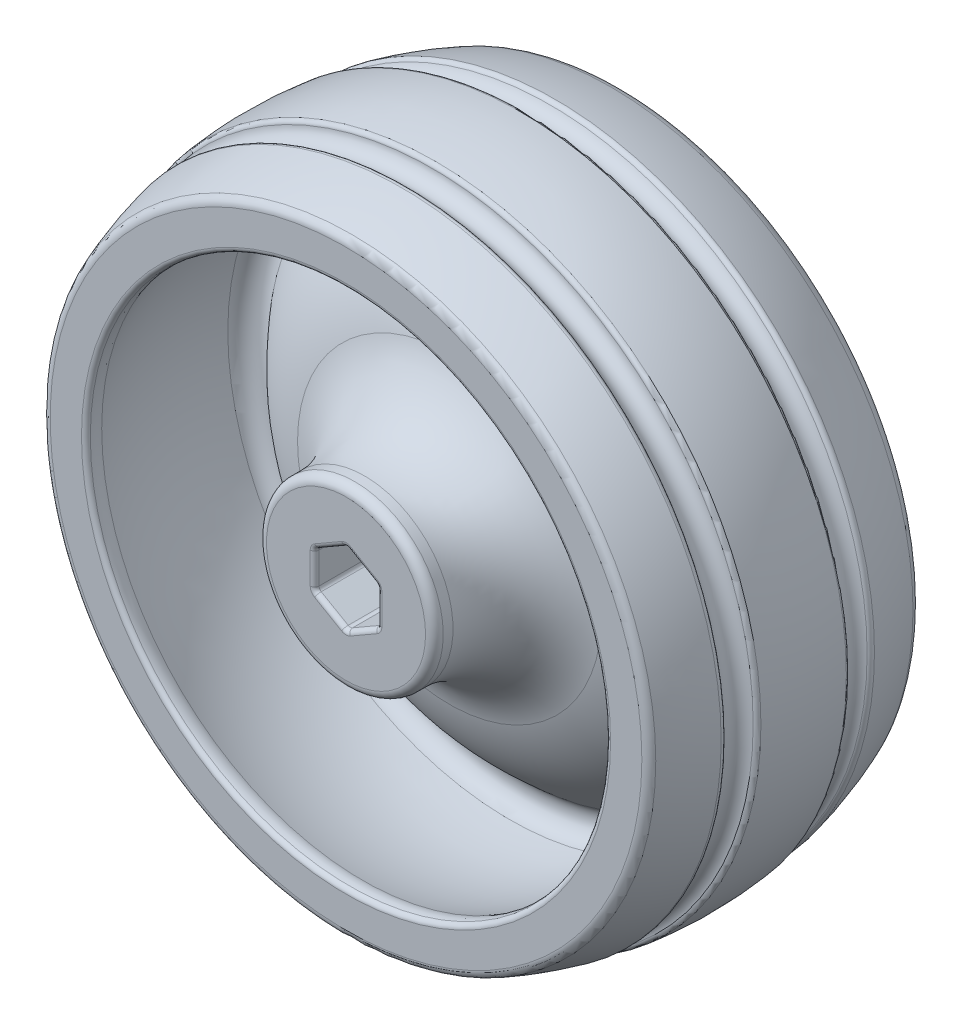
from build123d import *

# Parameters (mm, degrees)
SKETCH1_R           = 10
BOSS_EXTRUDE1_DEPTH = 15
FILLET1_R           = 10
CUT_EXTRUDE1_DEPTH  = 55.986436954
FILLET2_R           = 0.5
FILLET3_R           = 0.5
FILLET4_R           = 1
FILLET5_R           = 0.5
SKETCH5_R           = 36.834508169
CUT_EXTRUDE2_DEPTH  = 10
FILLET6_R           = 1
FILLET7_R           = 0.56


with BuildPart() as part:
    # Sketch1 → Boss-Extrude1 (new body)
    with BuildSketch(Plane.XY):
        Circle(SKETCH1_R)
        Polygon((0, 4.1), (-3.550704156, 2.05), (-3.550704156, -2.05), (0, -4.1), (3.550704156, -2.05), (3.550704156, 2.05), align=None, mode=Mode.SUBTRACT)
    extrude(amount=BOSS_EXTRUDE1_DEPTH)

    # Sketch3 → Revolve1 (revolve)
    with BuildSketch(Plane(origin=(0, 0, 0), x_dir=(1, 0, 0), z_dir=(0, 1, 0))):
        with BuildLine():
            Line((0, 0), (0, 2))
            add(Edge.make_bspline(
                [(0, 2), (-16.635779287, -1.704882491), (-22.019677578, 4.954669614), (-27.650661505, 11.418003497), (-29.619825905, 15.213752774)],
                knots=[0.020977686, 0.020977686, 0.020977686, 0.020977686, 0.802461476, 1.020977686, 1.020977686, 1.020977686, 1.020977686], degree=3))
            ThreePointArc((-29.619825905, 15.213752774), (-31.95663413, 16.559729671), (-34.156535975, 14.99999945))
            ThreePointArc((-34.156535975, 14.99999945), (-35.33748884, 11.662912363), (-36.218783716, 8.234484263))
            ThreePointArc((-36.218783716, 8.234484263), (-35.021582874, 6.507540388), (-36.725775642, 5.278169813))
            ThreePointArc((-36.725775642, 5.278169813), (-37.075543317, 0), (-36.725775642, -5.278169813))
            ThreePointArc((-36.725775642, -5.278169813), (-35.021582874, -6.507540388), (-36.218783716, -8.234484263))
            ThreePointArc((-36.218783716, -8.234484263), (-35.337488853, -11.66291232), (-34.156536009, -14.999999367))
            ThreePointArc((-34.156536009, -14.999999367), (-30.90147392, -16.380062106), (-29.521411796, -13.124999757))
            ThreePointArc((-29.521411796, -13.124999757), (-31.724157563, -4.947072955), (-31.898033904, 3.520532533))
            ThreePointArc((-31.898033904, 3.520532533), (-30.508836406, 5.227030135), (-28.392540509, 4.624290199))
            add(Edge.make_bspline(
                [(-28.392540509, 4.624290199), (-28.301822083, 4.518923577), (-27.959241842, 4.121852954), (-27.210641015, 3.269867094), (-25.629718271, 1.587291662), (-22.961691931, -0.755282387), (-18.636561665, -3.052293704), (-14.377715965, -4.032407604), (-11.334423838, -4.235103563), (-10.267706955, -4.251881481), (-10, -4.252879424)],
                knots=[0.25424829, 0.25424829, 0.25424829, 0.25424829, 0.269873288, 0.3125, 0.375, 0.5, 0.625, 0.75, 0.797337009, 0.812962009, 0.812962009, 0.812962009, 0.812962009], degree=3))
            Line((-10, -4.252879424), (-10, 0))
            Line((-10, 0), (0, 0))
        make_face()
    revolve(axis=Axis((0, 0, -15), (0, 0, 1)))

    # Fillet1
    fillet1_edges = [part.edges().sort_by_distance(p)[0] for p in [
        (0, 10, 4.252879424),
    ]]
    fillet(fillet1_edges, radius=FILLET1_R)

    # Sketch4 → Cut-Extrude1 (cut, through all)
    with BuildSketch(Plane.XY):
        Polygon((3.550704156, 2.05), (0, 4.1), (-3.550704156, 2.05), (-3.550704156, -2.05), (0, -4.1), (3.550704156, -2.05), align=None)
    extrude(amount=-CUT_EXTRUDE1_DEPTH, mode=Mode.SUBTRACT)

    # Fillet2
    fillet2_edges = [part.edges().sort_by_distance(p)[0] for p in [
        (-3.550704156, -2.05, 6.88774468),
        (0, -4.1, 6.88774468),
        (3.550704156, -2.05, 6.88774468),
        (3.550704156, 2.05, 6.88774468),
        (0, 4.1, 6.88774468),
        (-3.550704156, 2.05, 6.88774468),
    ]]
    fillet(fillet2_edges, radius=FILLET2_R)

    # Fillet3
    fillet3_edges = [part.edges().sort_by_distance(p)[0] for p in [
        (-3.483716857, 2.011324865, -1.236323971),
        (-1.775352077, 3.075000001, -1.310968429),
        (0, 4.022649731, -1.236323971),
        (1.775352084, 3.074999997, -1.310968429),
        (3.483716857, 2.011324865, -1.236323971),
        (3.550704156, -7e-09, -1.310968429),
        (3.483716857, -2.011324865, -1.236323971),
        (1.775352072, -3.075000003, -1.310968429),
        (0, -4.022649731, -1.236323971),
        (-1.775352084, -3.074999997, -1.310968429),
        (-3.483716857, -2.011324865, -1.236323971),
        (-3.483716857, 2.011324865, 15),
        (-1.775352078, 3.075, 15),
        (0, 4.022649731, 15),
        (1.775352078, 3.075, 15),
        (3.483716857, 2.011324865, 15),
        (3.550704156, 0, 15),
        (3.483716857, -2.011324865, 15),
        (1.775352078, -3.075, 15),
        (0, -4.022649731, 15),
        (-1.775352078, -3.075, 15),
        (-3.483716857, -2.011324865, 15),
        (-19.276689128, 0, -3.025551502),
        (-3.550704156, 0, 15),
    ]]
    fillet(fillet3_edges, radius=FILLET3_R)

    # Fillet4
    fillet4_edges = [part.edges().sort_by_distance(p)[0] for p in [
        (-10, 0, 15),
    ]]
    fillet(fillet4_edges, radius=FILLET4_R)

    # Fillet5
    fillet5_edges = [part.edges().sort_by_distance(p)[0] for p in [
        (36.218783716, 0, -8.234484263),
        (36.725775642, 0, -5.278169813),
        (36.725775642, 0, 5.278169813),
        (36.218783716, 0, 8.234484263),
    ]]
    fillet(fillet5_edges, radius=FILLET5_R)

    # Sketch5 → Cut-Extrude2 (cut)
    with BuildSketch(Plane.XY.offset(15)):
        Circle(SKETCH5_R)
    extrude(amount=CUT_EXTRUDE2_DEPTH, mode=Mode.SUBTRACT)

    # Fillet6
    fillet6_edges = [part.edges().sort_by_distance(p)[0] for p in [
        (34.156536009, 0, 14.999999367),
    ]]
    fillet(fillet6_edges, radius=FILLET6_R)

    # Fillet7
    fillet7_edges = [part.edges().sort_by_distance(p)[0] for p in [
        (29.521411698, 0, 15),
    ]]
    fillet(fillet7_edges, radius=FILLET7_R)


solid = part.part
